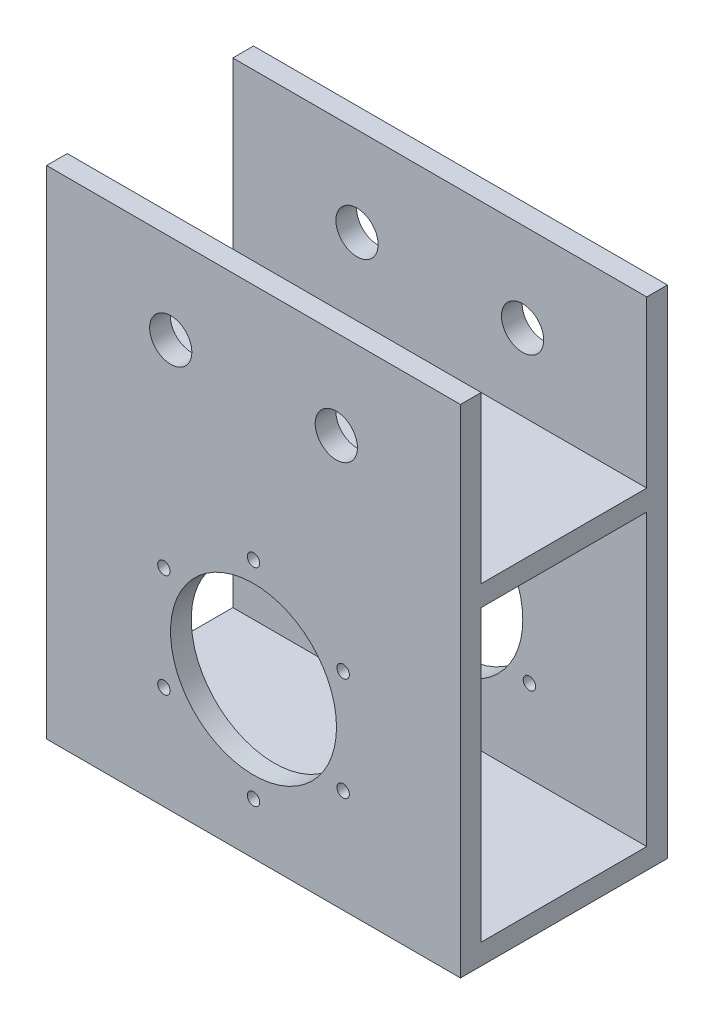
from build123d import *

# Parameters (mm, degrees)
SKETCH1_W                = 100
SKETCH1_H                = 120
BOSS_EXTRUDE1_DEPTH      = 5
SKETCH2_W                = 100
SKETCH2_H                = 5
BOSS_EXTRUDE2_DEPTH      = 45
BOSS_EXTRUDE3_DEPTH      = 40
BOSS_EXTRUDE3_DEPTH_BACK = 60
SKETCH3_W                = 100
SKETCH3_H                = 5
SKETCH6_W                = 100
SKETCH6_H                = 5
BOSS_EXTRUDE4_DEPTH      = 15
SKETCH7_W                = 100
SKETCH7_H                = 5
BOSS_EXTRUDE5_DEPTH      = 45
SKETCH8_R                = 20.05
SKETCH8_R_2              = 1.5
CUT_EXTRUDE1_DEPTH       = 93.736184955
SKETCH10_R               = 5.1
CUT_EXTRUDE2_DEPTH       = 93.736184955


with BuildPart() as part:
    # Sketch1 → Boss-Extrude1 (new body)
    with BuildSketch(Plane.XY):
        Rectangle(SKETCH1_W, SKETCH1_H)
    extrude(amount=BOSS_EXTRUDE1_DEPTH)

    # Sketch2 → Boss-Extrude2 (add)
    with BuildSketch(Plane.XY.offset(5)):
        with Locations((0, 17.5)):
            Rectangle(SKETCH2_W, SKETCH2_H)
    extrude(amount=BOSS_EXTRUDE2_DEPTH)

    # Sketch3 → Boss-Extrude3 (add, two sides: drawn at the far end of the back side and taken through both)
    with BuildSketch(Plane(origin=(0, 20, 0), x_dir=(1, 0, 0), z_dir=(0, 1, 0)).offset(-BOSS_EXTRUDE3_DEPTH_BACK)):
        with Locations((0, -47.5)):
            Rectangle(SKETCH3_W, SKETCH3_H)
    extrude(amount=BOSS_EXTRUDE3_DEPTH + BOSS_EXTRUDE3_DEPTH_BACK)

    # Sketch6 → Boss-Extrude4 (add)
    with BuildSketch(Plane.XZ.offset(40)):
        with Locations((0, 47.5)):
            Rectangle(SKETCH6_W, SKETCH6_H)
        with Locations((0, 2.5)):
            Rectangle(SKETCH6_W, SKETCH6_H)
    extrude(amount=BOSS_EXTRUDE4_DEPTH)

    # Sketch7 → Boss-Extrude5 (add)
    with BuildSketch(Plane.XY.offset(5)):
        with Locations((0, -57.5)):
            Rectangle(SKETCH7_W, SKETCH7_H)
    extrude(amount=BOSS_EXTRUDE5_DEPTH)

    # Sketch8 → Cut-Extrude1 (cut, through all)
    with BuildSketch(Plane.XY.offset(50)):
        with Locations((0, -22.5)):
            Circle(SKETCH8_R)
        with Locations((0, 2.5)):
            Circle(SKETCH8_R_2)
        with Locations((21.650635095, -10)):
            Circle(SKETCH8_R_2)
        with Locations((21.650635095, -35)):
            Circle(SKETCH8_R_2)
        with Locations((0, -47.5)):
            Circle(SKETCH8_R_2)
        with Locations((-21.650635095, -35)):
            Circle(SKETCH8_R_2)
        with Locations((-21.650635095, -10)):
            Circle(SKETCH8_R_2)
    extrude(amount=-CUT_EXTRUDE1_DEPTH, mode=Mode.SUBTRACT)

    # Sketch10 → Cut-Extrude2 (cut, through all)
    with BuildSketch(Plane.XY.offset(50)):
        with Locations((-20, 38.494629442)):
            Circle(SKETCH10_R)
        with Locations((20, 38.494629442)):
            Circle(SKETCH10_R)
    extrude(amount=-CUT_EXTRUDE2_DEPTH, mode=Mode.SUBTRACT)


solid = part.part
